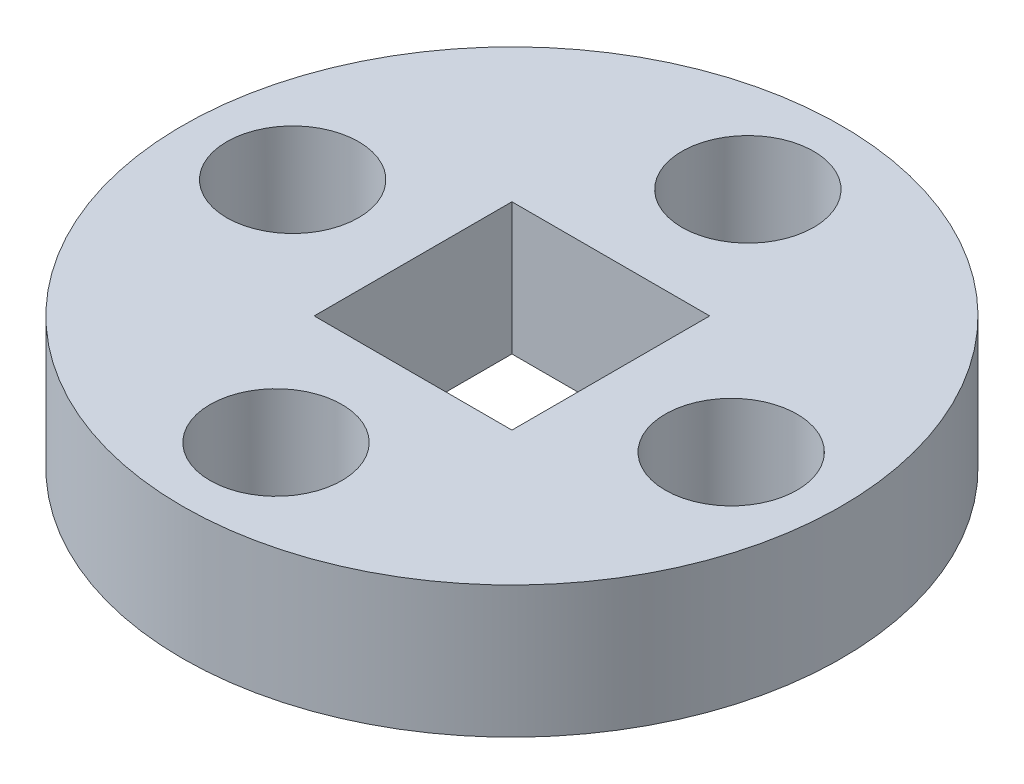
from build123d import *

# Parameters (mm, degrees)
SKIZZE1_R                       = 5
AUFSATZ_LINEAR_AUSTRAGEN1_DEPTH = 2
SKIZZE3_W                       = 3
SKIZZE3_H                       = 3
SCHNITT_LINEAR_AUSTRAGEN1_DEPTH = 3
SKIZZE4_R                       = 1
SCHNITT_LINEAR_AUSTRAGEN2_DEPTH = 3
KREISMUSTER1_COUNT              = 4


with BuildPart() as part:
    # Skizze1 → Aufsatz-Linear austragen1 (new body)
    with BuildSketch(Plane(origin=(0, 0, 0), x_dir=(1, 0, 0), z_dir=(0, 1, 0))):
        Circle(SKIZZE1_R)
    extrude(amount=AUFSATZ_LINEAR_AUSTRAGEN1_DEPTH)

    # Skizze3 → Schnitt-Linear austragen1 (cut)
    with BuildSketch(Plane(origin=(0, 2, 0), x_dir=(1, 0, 0), z_dir=(0, 1, 0))):
        Rectangle(SKIZZE3_W, SKIZZE3_H)
    extrude(amount=-SCHNITT_LINEAR_AUSTRAGEN1_DEPTH, mode=Mode.SUBTRACT)

    # Skizze4 → Schnitt-Linear austragen2 (cut)
    with BuildSketch(Plane(origin=(0, 2, 0), x_dir=(1, 0, 0), z_dir=(0, 1, 0))):
        with Locations((3.452809927, -0.126446108)):
            Circle(SKIZZE4_R)
    schnitt_linear_austragen2 = extrude(amount=-SCHNITT_LINEAR_AUSTRAGEN2_DEPTH, mode=Mode.SUBTRACT)

    # Kreismuster1: Schnitt-Linear austragen2 ×4 about axis
    kreismuster1_axis = Axis((0, 2, 0), (0, -1, 0))
    for i in range(1, KREISMUSTER1_COUNT):
        add(schnitt_linear_austragen2.rotate(kreismuster1_axis, i * 360 / KREISMUSTER1_COUNT), mode=Mode.SUBTRACT)


solid = part.part
